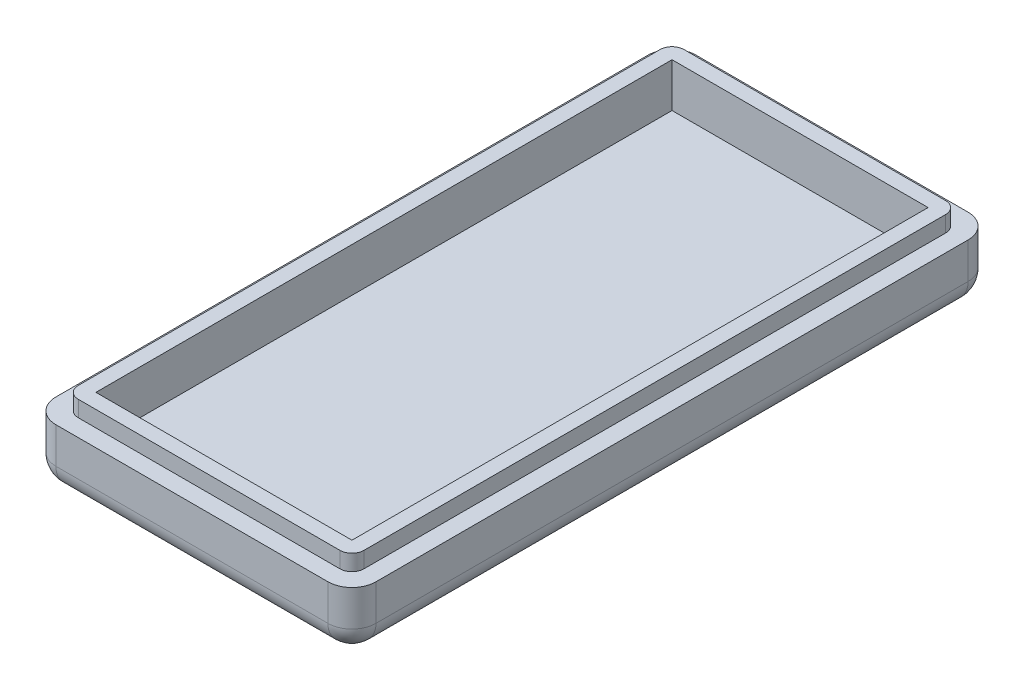
from build123d import *

# Parameters (mm, degrees)
SKETCH1_W           = 40
SKETCH1_H           = 7.5
BOSS_EXTRUDE1_DEPTH = 80
SHELL1_T            = -4
FILLET1_R           = 3
SKETCH2_W           = 32
SKETCH2_H           = 72
BOSS_EXTRUDE2_DEPTH = 2


with BuildPart() as part:
    # Sketch1 → Boss-Extrude1 (new body)
    with BuildSketch(Plane.XY):
        with Locations((20, 3.75)):
            Rectangle(SKETCH1_W, SKETCH1_H)
    extrude(amount=BOSS_EXTRUDE1_DEPTH)

    # Shell1
    shell1_openings = [part.faces().sort_by_distance(p)[0] for p in [
        (20, 7.5, 40),
    ]]
    offset(amount=SHELL1_T, openings=shell1_openings, kind=Kind.INTERSECTION)

    # Fillet1
    fillet1_edges = [part.edges().sort_by_distance(p)[0] for p in [
        (20, 0, 80),
        (0, 3.75, 80),
        (0, 0, 40),
        (40, 3.75, 80),
        (40, 0, 40),
        (40, 3.75, 0),
        (20, 0, 0),
        (0, 3.75, 0),
    ]]
    fillet(fillet1_edges, radius=FILLET1_R)

    # Sketch2 → Boss-Extrude2 (add)
    with BuildSketch(Plane(origin=(0, 7.5, 0), x_dir=(1, 0, 0), z_dir=(0, 1, 0))):
        with BuildLine():
            Line((3.65, -77.85), (36.35, -77.85))
            ThreePointArc((36.35, -77.85), (37.410660172, -77.410660172), (37.85, -76.35))
            Line((37.85, -76.35), (37.85, -3.65))
            ThreePointArc((37.85, -3.65), (37.410660172, -2.589339828), (36.35, -2.15))
            Line((36.35, -2.15), (3.65, -2.15))
            ThreePointArc((3.65, -2.15), (2.589339828, -2.589339828), (2.15, -3.65))
            Line((2.15, -3.65), (2.15, -76.35))
            ThreePointArc((2.15, -76.35), (2.589339828, -77.410660172), (3.65, -77.85))
        make_face()
        with Locations((20, -40)):
            Rectangle(SKETCH2_W, SKETCH2_H, mode=Mode.SUBTRACT)
    extrude(amount=BOSS_EXTRUDE2_DEPTH)


solid = part.part
